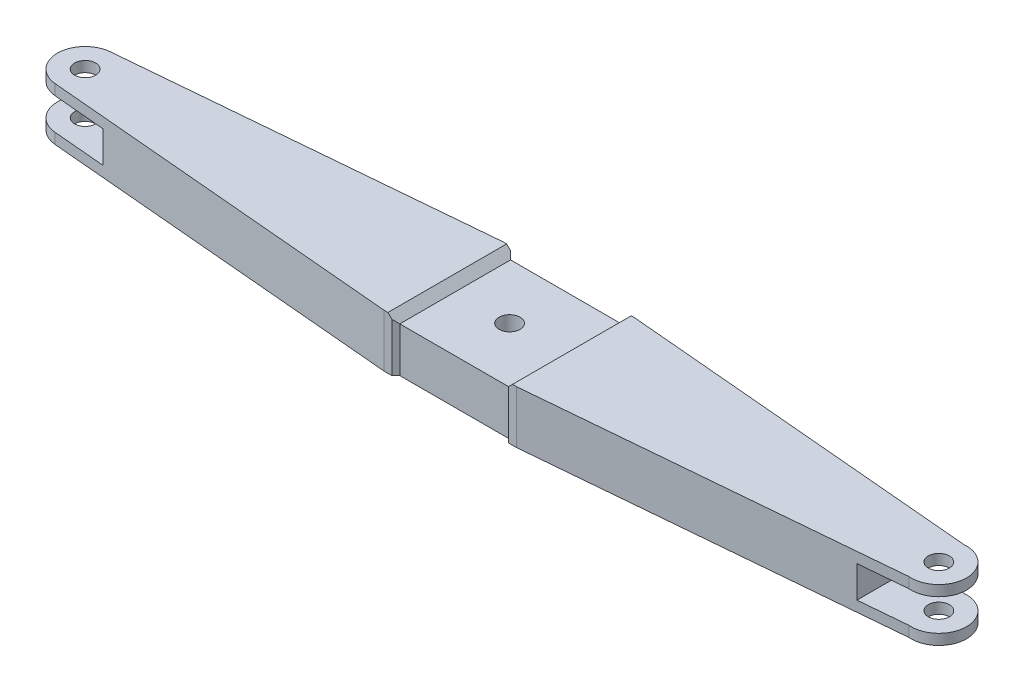
from build123d import *

# Parameters (mm, degrees)
CROQUIS1_R              = 4
SALIENTE_EXTRUIR1_DEPTH = 20
CROQUIS2_W              = 29.5
CROQUIS2_H              = 12
CORTAR_EXTRUIR1_DEPTH   = 180.732329924
CROQUIS3_W              = 41.22
CROQUIS3_H              = 42
CORTAR_EXTRUIR2_DEPTH   = 3
CHAFL_N1_SIZE           = 3
CROQUIS4_R              = 4
CORTAR_EXTRUIR3_DEPTH   = 176.518425627


with BuildPart() as part:
    # Croquis1 → Saliente-Extruir1 (new body)
    with BuildSketch(Plane(origin=(0, 0, 0), x_dir=(1, 0, 0), z_dir=(0, 1, 0))):
        with BuildLine():
            Line((20.61, 21), (22.109773483, 22.499773483))
            Line((22.109773483, 22.499773483), (25.109773482, 22.499825843))
            Line((25.109773482, 22.499825843), (161.820621985, 10.459829919))
            ThreePointArc((161.820621985, 10.459829919), (173.238204711, 0), (161.820621985, -10.459829919))
            Line((161.820621985, -10.459829919), (25.109773482, -22.499825843))
            Line((25.109773482, -22.499825843), (22.109773483, -22.499773483))
            Line((22.109773483, -22.499773483), (20.61, -21))
            Line((20.61, -21), (-20.61, -21))
            Line((-20.61, -21), (-22.109773483, -22.499773483))
            Line((-22.109773483, -22.499773483), (-25.109773482, -22.499825843))
            Line((-25.109773482, -22.499825843), (-161.820621985, -10.459829919))
            ThreePointArc((-161.820621985, -10.459829919), (-171.403039258, 0), (-161.820621985, 10.459829919))
            Line((-161.820621985, 10.459829919), (-25.109773482, 22.499825843))
            Line((-25.109773482, 22.499825843), (-22.109773483, 22.499773483))
            Line((-22.109773483, 22.499773483), (-20.61, 21))
            Line((-20.61, 21), (20.61, 21))
        make_face()
        with Locations(Location((-160.903039258, 0, 0), (0, 0, 270))):
            Circle(CROQUIS1_R, mode=Mode.SUBTRACT)
        with Locations(Location((162.738204711, 0, 0), (0, 0, 270))):
            Circle(CROQUIS1_R, mode=Mode.SUBTRACT)
    extrude(amount=SALIENTE_EXTRUIR1_DEPTH)

    # Croquis2 → Cortar-Extruir1 (cut, through all)
    with BuildSketch(Plane.XY.offset(21)):
        with Locations((-156.653039258, 10)):
            Rectangle(CROQUIS2_W, CROQUIS2_H)
        with Locations((158.488204711, 10)):
            Rectangle(CROQUIS2_W, CROQUIS2_H)
    extrude(amount=-CORTAR_EXTRUIR1_DEPTH, mode=Mode.SUBTRACT)

    # Croquis3 → Cortar-Extruir2 (cut)
    with BuildSketch(Plane(origin=(0, 20, 0), x_dir=(1, 0, 0), z_dir=(0, 1, 0))):
        Rectangle(CROQUIS3_W, CROQUIS3_H)
    extrude(amount=-CORTAR_EXTRUIR2_DEPTH, mode=Mode.SUBTRACT)

    # Chaflán1
    chafl_n1_edges = [part.edges().sort_by_distance(p)[0] for p in [
        (20.61, 20, 0),
        (-20.61, 20, 0),
    ]]
    chamfer(chafl_n1_edges, length=CHAFL_N1_SIZE - 0.0001)  # a hair under: the kernel refuses the full size

    # Croquis4 → Cortar-Extruir3 (cut, through all)
    with BuildSketch(Plane(origin=(0, 17, 0), x_dir=(1, 0, 0), z_dir=(0, 1, 0))):
        with Locations(Location((0, 0, 0), (0, 0, 270))):
            Circle(CROQUIS4_R)
    extrude(amount=-CORTAR_EXTRUIR3_DEPTH, mode=Mode.SUBTRACT)


solid = part.part
